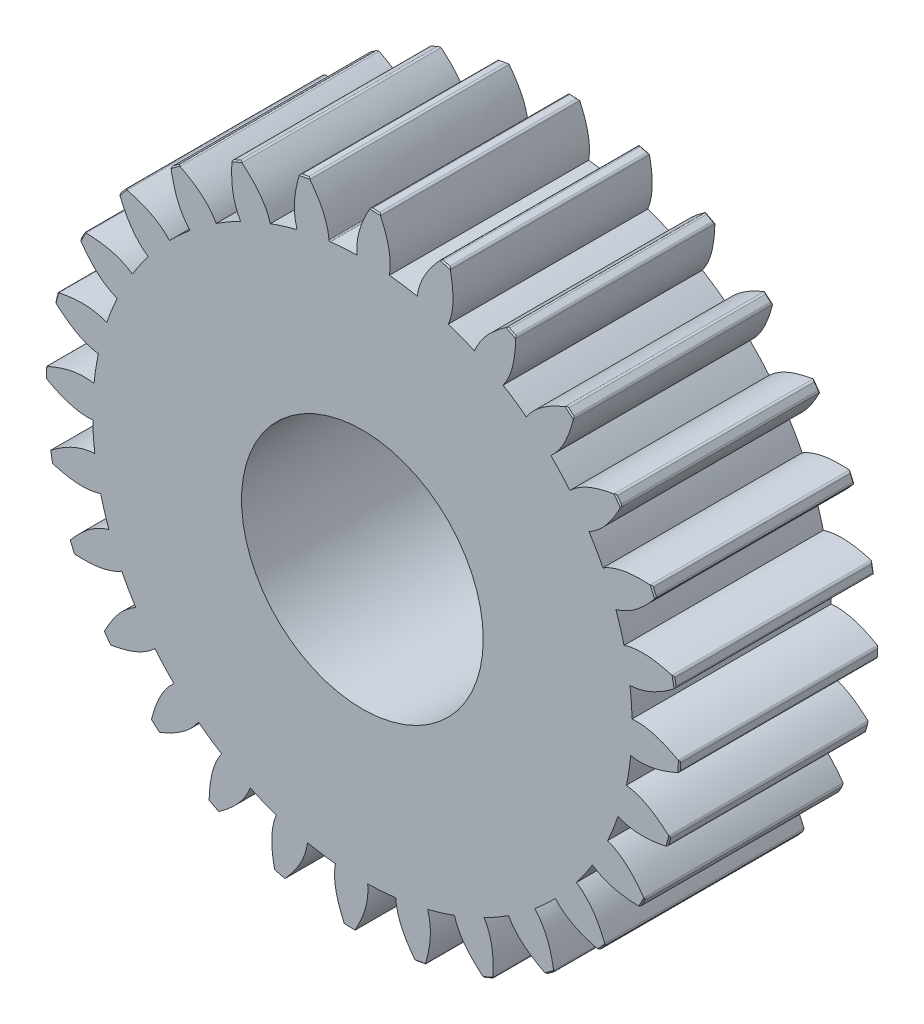
from build123d import *

# Parameters (mm, degrees)
BOSS_EXTRUDE2_DEPTH          = 32.97
FILLET1_R                    = 0.2
CHAMFER1_SIZE                = 0.2
FILLET2_R                    = 0.4
CIRPATTERN2_COUNT            = 28
CHAMFER1_OF_CIRPATTERN2_SIZE = 0.2
FILLET2_OF_CIRPATTERN2_R     = 0.4
SKETCH2_R                    = 20
CUT_EXTRUDE1_DEPTH           = 82.207468612


with BuildPart() as part:
    # Sketch1 → Boss-Extrude2 (new body)
    with BuildSketch(Plane.XY):
        with BuildLine():
            add(Edge.make_bspline(
                [(-5.51988784, 44.282292886), (-5.550998232, 44.876677985), (-5.640440326, 45.453372455), (-5.777673182, 46.013684025)],
                knots=[-0.082666239, -0.082666239, -0.082666239, -0.082666239, 0, 0, 0, 0], degree=3))
            ThreePointArc((-5.777673182, 46.013684025), (-8.488814698, 45.591453695), (-11.170240134, 45.009625197))
            add(Edge.make_bspline(
                [(-10.787607456, 43.301479771), (-10.972506359, 43.8672305), (-11.096615514, 44.437470207), (-11.170240134, 45.009625197)],
                knots=[-0.082666239, -0.082666239, -0.082666239, -0.082666239, 0, 0, 0, 0], degree=3))
            ThreePointArc((-10.787607456, 43.301479771), (-8.168482068, 43.87102148), (-5.51988784, 44.282292886))
        make_face()
        with BuildLine():
            ThreePointArc((-11.170240134, 45.009625197), (-8.488814698, 45.591453695), (-5.777673182, 46.013684025))
            add(Edge.make_bspline(
                [(-5.777673182, 46.013684025), (-5.886588914, 46.458378878), (-6.416566099, 48.114336675), (-7.533155051, 50.013750815), (-8.558989836, 51.403913659), (-8.829924983, 51.752124834)],
                knots=[0, 0, 0, 0, 0.065608588, 0.250117866, 0.313482638, 0.313482638, 0.313482638, 0.313482638], degree=3))
            ThreePointArc((-8.829924983, 51.752124834), (-9.609978973, 51.612966434), (-10.387843895, 51.462051059))
            add(Edge.make_bspline(
                [(-11.170240134, 45.009625197), (-11.228672783, 45.463719654), (-11.330204766, 47.199451007), (-10.972057362, 49.373450725), (-10.515298613, 51.039662432), (-10.387843895, 51.462051059)],
                knots=[0, 0, 0, 0, 0.065608588, 0.250117866, 0.313482631, 0.313482631, 0.313482631, 0.313482631], degree=3))
        make_face()
        with BuildLine():
            ThreePointArc((44.625, 0), (29.53866644, 33.44933198), (-5.51988784, 44.282292886))
            ThreePointArc((-5.51988784, 44.282292886), (-8.168482068, 43.87102148), (-10.787607456, 43.301479771))
            ThreePointArc((-10.787607456, 43.301479771), (-27.477205483, -35.162391896), (44.625, 0))
        make_face()
    boss_extrude2 = extrude(amount=BOSS_EXTRUDE2_DEPTH)

    # Fillet1
    fillet1_edges = [part.edges().sort_by_distance(p)[0] for p in [
        (-10.787607456, 43.301479771, 16.485),
        (-5.51988784, 44.282292886, 16.485),
    ]]
    fillet(fillet1_edges, radius=FILLET1_R)

    # Chamfer1
    chamfer1_edges = [part.edges().sort_by_distance(p)[0] for p in [
        (-9.609978973, 51.612966434, 32.97),
        (-9.609978973, 51.612966434, 0),
    ]]
    chamfer(chamfer1_edges, length=CHAMFER1_SIZE)

    # Fillet2
    # the kernel refuses this fillet: 0.4 mm, written as the material it takes off along each edge
    with BuildSketch(Plane(origin=(-8.829924983, 51.752124834, -0.407941324), x_dir=(0.6103688221827714, -0.7921173529895783, 0), z_dir=(0, 0, 1))) as fillet2_piece_1:
        with BuildLine():
            CenterArc((0.241289587, -0.399995549), FILLET2_R, 89.72971437, 62.600984781)
            ThreePointArc((-0.112967438, -0.214248516), (-0.056607272, -0.107059111), (0, 0))
            ThreePointArc((0, 0), (0.121588264, 0.000286369), (0.243176529, 0))
        make_face()
    extrude(amount=33.785882647, mode=Mode.SUBTRACT)
    with BuildSketch(Plane(origin=(-10.387843895, 51.462051059, -0.407941397), x_dir=(-0.2843762130038, -0.9587127669315859, 0), z_dir=(0, 0, 1))) as fillet2_piece_2:
        with BuildLine():
            CenterArc((0.241289616, 0.399995549), FILLET2_R, 207.66929474, 62.600990917)
            ThreePointArc((-0.112967429, 0.214248553), (-0.056607268, 0.10705913), (0, 0))
            ThreePointArc((0, 0), (0.121588278, -0.000286369), (0.243176559, 0))
        make_face()
    extrude(amount=33.785882793, mode=Mode.SUBTRACT)

    # CirPattern2: Boss-Extrude2 ×28 about axis
    cirpattern2_axis = Axis((0, 0, 32.97), (0, 0, 1))
    for i in range(1, CIRPATTERN2_COUNT):
        add(boss_extrude2.rotate(cirpattern2_axis, i * 360 / CIRPATTERN2_COUNT))

    # Chamfer1 of CirPattern2
    chamfer1_of_cirpattern2_edges = [part.edges().sort_by_distance(p)[0] for p in [
        (-20.854002231, 48.180500111, 32.97),
        (-20.854002231, 48.180500111, 0),
        (-31.052318739, 42.332062328, 32.97),
        (-31.052318739, 42.332062328, 0),
        (-39.693542322, 34.360918176, 32.97),
        (-39.693542322, 34.360918176, 0),
        (-46.344365947, 24.666774109, 32.97),
        (-46.344365947, 24.666774109, 0),
        (-50.671289547, 13.735734988, 32.97),
        (-50.671289547, 13.735734988, 0),
        (-52.457343104, 2.115928759, 32.97),
        (-52.457343104, 2.115928759, 0),
        (-51.612966434, -9.609978973, 32.97),
        (-51.612966434, -9.609978973, 0),
        (-48.180500111, -20.854002231, 32.97),
        (-48.180500111, -20.854002231, 0),
        (-42.332062328, -31.052318739, 32.97),
        (-42.332062328, -31.052318739, 0),
        (-34.360918176, -39.693542322, 32.97),
        (-34.360918176, -39.693542322, 0),
        (-24.666774109, -46.344365947, 32.97),
        (-24.666774109, -46.344365947, 0),
        (-13.735734988, -50.671289547, 32.97),
        (-13.735734988, -50.671289547, 0),
        (-2.115928759, -52.457343104, 32.97),
        (-2.115928759, -52.457343104, 0),
        (9.609978973, -51.612966434, 32.97),
        (9.609978973, -51.612966434, 0),
        (20.854002231, -48.180500111, 32.97),
        (20.854002231, -48.180500111, 0),
        (31.052318739, -42.332062328, 32.97),
        (31.052318739, -42.332062328, 0),
        (39.693542322, -34.360918176, 32.97),
        (39.693542322, -34.360918176, 0),
        (46.344365947, -24.666774109, 32.97),
        (46.344365947, -24.666774109, 0),
        (50.671289547, -13.735734988, 32.97),
        (50.671289547, -13.735734988, 0),
        (52.457343104, -2.115928759, 32.97),
        (52.457343104, -2.115928759, 0),
        (51.612966434, 9.609978973, 32.97),
        (51.612966434, 9.609978973, 0),
        (48.180500111, 20.854002231, 32.97),
        (48.180500111, 20.854002231, 0),
        (42.332062328, 31.052318739, 32.97),
        (42.332062328, 31.052318739, 0),
        (34.360918176, 39.693542322, 32.97),
        (34.360918176, 39.693542322, 0),
        (24.666774109, 46.344365947, 32.97),
        (24.666774109, 46.344365947, 0),
        (13.735734988, 50.671289547, 32.97),
        (13.735734988, 50.671289547, 0),
        (2.115928759, 52.457343104, 32.97),
        (2.115928759, 52.457343104, 0),
    ]]
    chamfer(chamfer1_of_cirpattern2_edges, length=CHAMFER1_OF_CIRPATTERN2_SIZE)

    # Fillet2 of CirPattern2
    # the kernel refuses this fillet: 0.4 mm, written as the material it takes off along each edge
    with BuildSketch(Plane(origin=(-20.124471481, 48.489747861, -0.407941324), x_dir=(0.7713282946617631, -0.6364374767832081, 0), z_dir=(0, 0, 1)), Plane(origin=(-30.409892946, 42.795892455, -0.407941324), x_dir=(0.8936101456599611, -0.44884396795944925, 0), z_dir=(0, 0, 1)), Plane(origin=(-39.170435398, 34.956072302, -0.407941324), x_dir=(0.9710826525637598, -0.23874354837300268, 0), z_dir=(0, 0, 1)), Plane(origin=(-45.966808658, 25.363408719, -0.407941324), x_dir=(0.9998610203799786, -0.016671530364907757, 0), z_dir=(0, 0, 1)), Plane(origin=(-50.458214191, 14.498917915, -0.407941324), x_dir=(0.9785021815783183, 0.20623646778994198, 0), z_dir=(0, 0, 1)), Plane(origin=(-52.419434169, 2.907390824, -0.407941324), x_dir=(0.9080771575230531, 0.41880290828127315, 0), z_dir=(0, 0, 1)), Plane(origin=(-51.752124834, -8.829924983, -0.407941324), x_dir=(0.7921173529895789, 0.6103688221827707, 0), z_dir=(0, 0, 1)), Plane(origin=(-48.489747861, -20.124471481, -0.407941324), x_dir=(0.6364374767832152, 0.7713282946617571, 0), z_dir=(0, 0, 1)), Plane(origin=(-42.795892455, -30.409892946, -0.407941324), x_dir=(0.4488439679594434, 0.8936101456599641, 0), z_dir=(0, 0, 1)), Plane(origin=(-34.956072302, -39.170435398, -0.407941324), x_dir=(0.23874354837300268, 0.9710826525637598, 0), z_dir=(0, 0, 1)), Plane(origin=(-25.363408719, -45.966808658, -0.407941324), x_dir=(0.01667153036489461, 0.9998610203799788, 0), z_dir=(0, 0, 1)), Plane(origin=(-14.498917915, -50.458214191, -0.407941324), x_dir=(-0.20623646778991403, 0.9785021815783242, 0), z_dir=(0, 0, 1)), Plane(origin=(-2.907390824, -52.419434169, -0.407941324), x_dir=(-0.41880290828130623, 0.9080771575230376, 0), z_dir=(0, 0, 1)), Plane(origin=(8.829924983, -51.752124834, -0.407941324), x_dir=(-0.6103688221827666, 0.7921173529895822, 0), z_dir=(0, 0, 1)), Plane(origin=(20.124471481, -48.489747861, -0.407941324), x_dir=(-0.7713282946618002, 0.636437476783163, 0), z_dir=(0, 0, 1)), Plane(origin=(30.409892946, -42.795892455, -0.407941324), x_dir=(-0.8936101456599758, 0.4488439679594201, 0), z_dir=(0, 0, 1)), Plane(origin=(39.170435398, -34.956072302, -0.407941324), x_dir=(-0.9710826525637514, 0.23874354837303702, 0), z_dir=(0, 0, 1)), Plane(origin=(45.966808658, -25.363408719, -0.407941324), x_dir=(-0.9998610203799788, 0.016671530364894126, 0), z_dir=(0, 0, 1)), Plane(origin=(50.458214191, -14.498917915, -0.407941324), x_dir=(-0.978502181578318, -0.2062364677899431, 0), z_dir=(0, 0, 1)), Plane(origin=(52.419434169, -2.907390824, -0.407941324), x_dir=(-0.9080771575230379, -0.41880290828130584, 0), z_dir=(0, 0, 1)), Plane(origin=(51.752124834, 8.829924983, -0.407941324), x_dir=(-0.7921173529895783, -0.6103688221827714, 0), z_dir=(0, 0, 1)), Plane(origin=(48.489747861, 20.124471481, -0.407941324), x_dir=(-0.6364374767831743, -0.7713282946617909, 0), z_dir=(0, 0, 1)), Plane(origin=(42.795892455, 30.409892946, -0.407941324), x_dir=(-0.44884396795943765, -0.893610145659967, 0), z_dir=(0, 0, 1)), Plane(origin=(34.956072302, 39.170435398, -0.407941324), x_dir=(-0.23874354837300946, -0.9710826525637581, 0), z_dir=(0, 0, 1)), Plane(origin=(25.363408719, 45.966808658, -0.407941324), x_dir=(-0.016671530364894126, -0.9998610203799788, 0), z_dir=(0, 0, 1)), Plane(origin=(14.498917915, 50.458214191, -0.407941324), x_dir=(0.20623646778993499, -0.9785021815783198, 0), z_dir=(0, 0, 1)), Plane(origin=(2.907390824, 52.419434169, -0.407941324), x_dir=(0.41880290828128064, -0.9080771575230495, 0), z_dir=(0, 0, 1))) as fillet2_of_cirpattern2_piece_1:
        with BuildLine():
            CenterArc((0.241289587, -0.399995549), FILLET2_OF_CIRPATTERN2_R, 89.72971437, 62.600984781)
            ThreePointArc((-0.112967438, -0.214248516), (-0.056607272, -0.107059111), (0, 0))
            ThreePointArc((0, 0), (0.121588264, 0.000286369), (0.243176529, 0))
        make_face()
    extrude(amount=33.785882647, mode=Mode.SUBTRACT)
    with BuildSketch(Plane(origin=(-21.578782625, 47.860277271, -0.407941397), x_dir=(-0.06391264732450415, -0.997955496759236, 0), z_dir=(0, 0, 1)), Plane(origin=(-31.68767109, 41.858589332, -0.407941397), x_dir=(0.1597557653676177, -0.9871565708801248, 0), z_dir=(0, 0, 1)), Plane(origin=(-40.20760741, 33.757936939, -0.407941397), x_dir=(0.37541335690219363, -0.9268574925302303, 0), z_dir=(0, 0, 1)), Plane(origin=(-46.711366402, 23.964520626, -0.407941397), x_dir=(0.572246155132061, -0.8200819092850257, 0), z_dir=(0, 0, 1)), Plane(origin=(-50.872822433, 12.969423183, -0.407941397), x_dir=(0.7403841416517694, -0.6721839947444247, 0), z_dir=(0, 0, 1)), Plane(origin=(-52.483302721, 1.323984705, -0.407941397), x_dir=(0.8713961757341117, -0.49057996791141545, 0), z_dir=(0, 0, 1)), Plane(origin=(-51.462051059, -10.387843895, -0.407941397), x_dir=(0.958712766931586, -0.2843762130038, 0), z_dir=(0, 0, 1)), Plane(origin=(-47.860277271, -21.578782625, -0.407941397), x_dir=(0.9979554967592351, -0.0639126473245187, 0), z_dir=(0, 0, 1)), Plane(origin=(-41.858589332, -31.68767109, -0.407941397), x_dir=(0.9871565708801248, 0.1597557653676177, 0), z_dir=(0, 0, 1)), Plane(origin=(-33.757936939, -40.20760741, -0.407941397), x_dir=(0.9268574925302285, 0.3754133569021984, 0), z_dir=(0, 0, 1)), Plane(origin=(-23.964520626, -46.711366402, -0.407941397), x_dir=(0.8200819092850107, 0.5722461551320825, 0), z_dir=(0, 0, 1)), Plane(origin=(-12.969423183, -50.872822433, -0.407941397), x_dir=(0.6721839947444312, 0.7403841416517635, 0), z_dir=(0, 0, 1)), Plane(origin=(-1.323984705, -52.483302721, -0.407941397), x_dir=(0.4905799679114223, 0.8713961757341075, 0), z_dir=(0, 0, 1)), Plane(origin=(10.387843895, -51.462051059, -0.407941397), x_dir=(0.2843762130038, 0.9587127669315859, 0), z_dir=(0, 0, 1)), Plane(origin=(21.578782625, -47.860277271, -0.407941397), x_dir=(0.06391264732448775, 0.9979554967592371, 0), z_dir=(0, 0, 1)), Plane(origin=(31.68767109, -41.858589332, -0.407941397), x_dir=(-0.1597557653676177, 0.9871565708801248, 0), z_dir=(0, 0, 1)), Plane(origin=(40.20760741, -33.757936939, -0.407941397), x_dir=(-0.37541335690220856, 0.9268574925302243, 0), z_dir=(0, 0, 1)), Plane(origin=(46.711366402, -23.964520626, -0.407941397), x_dir=(-0.5722461551320817, 0.8200819092850113, 0), z_dir=(0, 0, 1)), Plane(origin=(50.872822433, -12.969423183, -0.407941397), x_dir=(-0.7403841416517539, 0.6721839947444418, 0), z_dir=(0, 0, 1)), Plane(origin=(52.483302721, -1.323984705, -0.407941397), x_dir=(-0.8713961757341045, 0.4905799679114279, 0), z_dir=(0, 0, 1)), Plane(origin=(51.462051059, 10.387843895, -0.407941397), x_dir=(-0.958712766931586, 0.2843762130038, 0), z_dir=(0, 0, 1)), Plane(origin=(47.860277271, 21.578782625, -0.407941397), x_dir=(-0.997955496759237, 0.06391264732448773, 0), z_dir=(0, 0, 1)), Plane(origin=(41.858589332, 31.68767109, -0.407941397), x_dir=(-0.9871565708801248, -0.1597557653676177, 0), z_dir=(0, 0, 1)), Plane(origin=(33.757936939, 40.20760741, -0.407941397), x_dir=(-0.9268574925302202, -0.3754133569022187, 0), z_dir=(0, 0, 1)), Plane(origin=(23.964520626, 46.711366402, -0.407941397), x_dir=(-0.820081909284994, -0.5722461551321063, 0), z_dir=(0, 0, 1)), Plane(origin=(12.969423183, 50.872822433, -0.407941397), x_dir=(-0.6721839947444062, -0.7403841416517862, 0), z_dir=(0, 0, 1)), Plane(origin=(1.323984705, 52.483302721, -0.407941397), x_dir=(-0.4905799679114417, -0.8713961757340967, 0), z_dir=(0, 0, 1))) as fillet2_of_cirpattern2_piece_2:
        with BuildLine():
            CenterArc((0.241289616, 0.399995549), FILLET2_OF_CIRPATTERN2_R, 207.66929474, 62.600990917)
            ThreePointArc((-0.112967429, 0.214248553), (-0.056607268, 0.10705913), (0, 0))
            ThreePointArc((0, 0), (0.121588278, -0.000286369), (0.243176559, 0))
        make_face()
    extrude(amount=33.785882793, mode=Mode.SUBTRACT)

    # Sketch2 → Cut-Extrude1 (cut, through all)
    with BuildSketch(Plane.XY.offset(32.97)):
        Circle(SKETCH2_R)
    extrude(amount=-CUT_EXTRUDE1_DEPTH, mode=Mode.SUBTRACT)


solid = part.part
